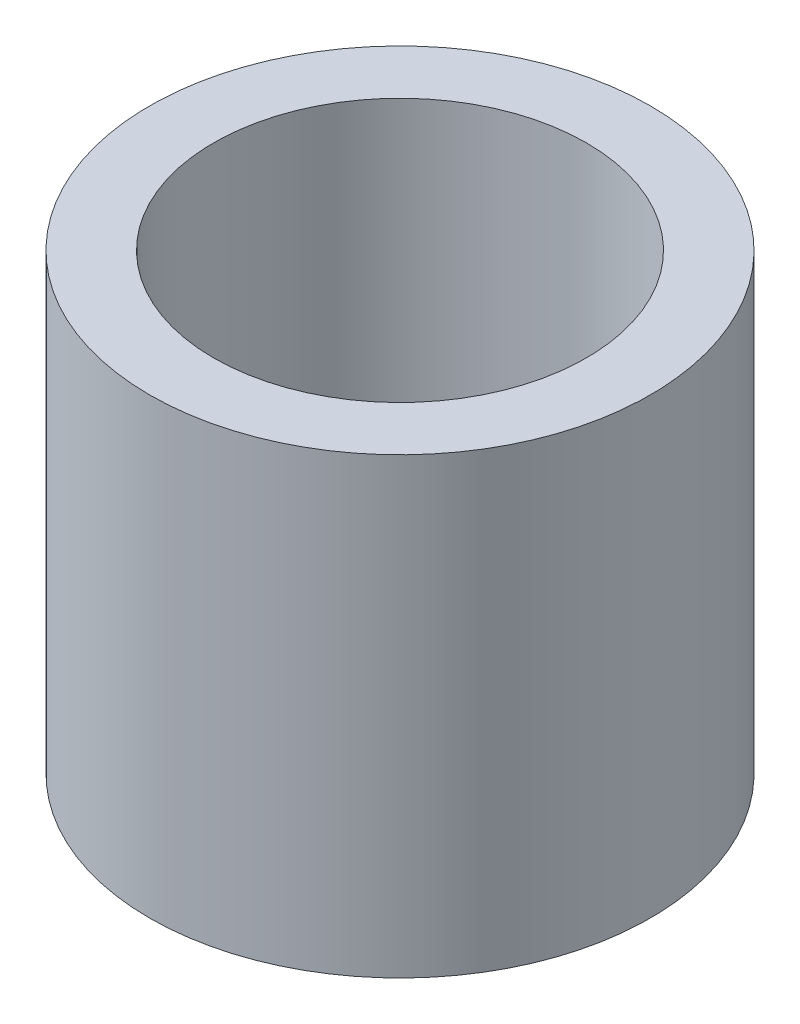
from build123d import *

# Parameters (mm, degrees)
SKETCH1_W = 0.565
SKETCH1_H = 4


with BuildPart() as part:
    # Sketch1 → Revolve1 (revolve)
    with BuildSketch(Plane.XY):
        with Locations((1.9275, 2)):
            Rectangle(SKETCH1_W, SKETCH1_H)
    revolve(axis=Axis((0, 0, 0), (0, 1, 0)))


solid = part.part
